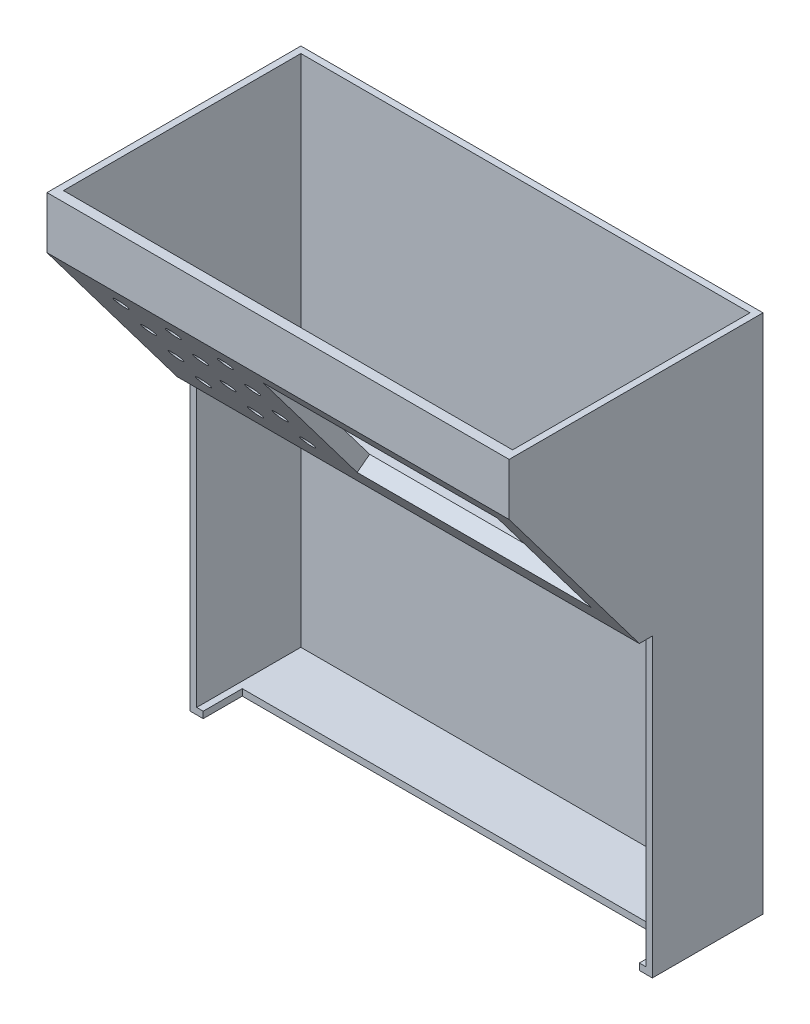
from build123d import *

# Parameters (mm, degrees)
SKETCH1_W                 = 200
SKETCH1_H                 = 177.5
BOSS_EXTRUDE1_DEPTH       = 2.5
BOSS_EXTRUDE2_DEPTH       = 40
SKETCH5_W                 = 86.25
SKETCH5_H                 = 95
BOSS_EXTRUDE3_DEPTH       = 2.5
CUT_EXTRUDE1_DEPTH        = 285.62694883
CUT_EXTRUDE1_DEPTH_BACK   = 285.62694883
BOSS_EXTRUDE4_START       = -177.5
BOSS_EXTRUDE4_DEPTH       = 177.5
SKETCH9_W                 = 167.5
SKETCH9_H                 = 15
CUT_EXTRUDE2_DEPTH        = 285.62694883
SKETCH15_R                = 2.65
CUT_EXTRUDE5_DEPTH        = 10
LPATTERN1_COUNT           = 4
LPATTERN1_PITCH           = 17.5
LPATTERN2_COUNT           = 3
LPATTERN2_PITCH           = 20
LPATTERN2_COPY_1_SKETCH_R = 2.65
LPATTERN2_COPY_1_DEPTH    = 10
LPATTERN2_COPY_2_SKETCH_R = 2.65
LPATTERN2_COPY_2_DEPTH    = 10
LPATTERN2_COPY_3_SKETCH_R = 2.65
LPATTERN2_COPY_3_DEPTH    = 10
LPATTERN2_COPY_4_SKETCH_R = 2.65
LPATTERN2_COPY_4_DEPTH    = 10
LPATTERN2_COPY_5_SKETCH_R = 2.65
LPATTERN2_COPY_5_DEPTH    = 10
LPATTERN2_COPY_6_SKETCH_R = 2.65
LPATTERN2_COPY_6_DEPTH    = 10
SKETCH16_W                = 90
SKETCH16_H                = 60
CUT_EXTRUDE6_DEPTH        = 10


# Read off the part's stored shape, not the designer's step: Boss-Extrude2
with BuildPart() as part:
    # Sketch1 → Boss-Extrude1 (new body)
    with BuildSketch(Plane(origin=(0, 0, 0), x_dir=(0, 1, 0), z_dir=(0, 0, 1))):
        with Locations((100, 88.75)):
            Rectangle(SKETCH1_W, SKETCH1_H)
    extrude(amount=BOSS_EXTRUDE1_DEPTH)

    # Boss-Extrude2 outline → Boss-Extrude2 (add)
    with BuildSketch(Plane.XY.offset(2.5)):
        Polygon((-177.5, 143.75), (-177.5, 0), (0, 0), (0, 143.75), (-2.5, 143.75), (-2.5, 2.5), (-175, 2.5), (-175, 143.75), align=None)
    extrude(amount=BOSS_EXTRUDE2_DEPTH)

    # Sketch5 → Boss-Extrude3 (add)
    with BuildSketch(Plane.YZ):
        with Locations((156.875, 50)):
            Rectangle(SKETCH5_W, SKETCH5_H)
    boss_extrude3 = extrude(amount=-BOSS_EXTRUDE3_DEPTH)

    # Mirror2: Boss-Extrude3 across plane
    add(boss_extrude3.mirror(Plane(origin=(-88.75, 0, 0), x_dir=(0, 0, 1), z_dir=(1, 0, 0))))

    # Sketch6 → Cut-Extrude1 (cut, two sides: drawn at the far end of the back side and taken through both)
    with BuildSketch(Plane.YZ.offset(-CUT_EXTRUDE1_DEPTH_BACK)):
        Polygon((113.75, 97.5), (113.75, 42.5), (180, 97.5), align=None)
    extrude(amount=CUT_EXTRUDE1_DEPTH + CUT_EXTRUDE1_DEPTH_BACK, mode=Mode.SUBTRACT)

    # Sketch7 → Boss-Extrude4 (add)
    with BuildSketch(Plane.YZ.offset(BOSS_EXTRUDE4_START)):
        Polygon((113.75, 47.5), (113.75, 42.5), (123.75, 42.5), (123.75, 47.5), (184.943404756, 93.683701702), (200, 93.683701702), (200, 97.5), (180, 97.5), align=None)
    extrude(amount=BOSS_EXTRUDE4_DEPTH)

    # Sketch9 → Cut-Extrude2 (cut, through all)
    with BuildSketch(Plane.XZ):
        with Locations((-88.75, 35)):
            Rectangle(SKETCH9_W, SKETCH9_H)
    extrude(amount=-CUT_EXTRUDE2_DEPTH, mode=Mode.SUBTRACT)

    # Sketch15 → Cut-Extrude5 (cut)
    with BuildSketch(Plane(origin=(0, 18.439555455, -24.432410978), x_dir=(1, 0, 0), z_dir=(0, -0.6024069059118725, 0.7981891503332306))):
        with Locations(Location((-157.5, 188.315762576, 0), (0, 0, 270))):
            Circle(SKETCH15_R)
    cut_extrude5 = extrude(amount=-CUT_EXTRUDE5_DEPTH, mode=Mode.SUBTRACT)

    # LPattern1: Cut-Extrude5 ×4
    with Locations(*[Vector(0, -0.7981891503332306, -0.6024069059118724) * (i * LPATTERN1_PITCH) for i in range(1, LPATTERN1_COUNT)]):
        add(cut_extrude5, mode=Mode.SUBTRACT)

    # LPattern2: Cut-Extrude5 ×3
    with Locations(*[(i * LPATTERN2_PITCH, 0, 0) for i in range(1, LPATTERN2_COUNT)]):
        add(cut_extrude5, mode=Mode.SUBTRACT)

    # LPattern2 copy 1 sketch → LPattern2 copy 1 (cut)
    with BuildSketch(Plane(origin=(20, 4.471245324, -34.974531831), x_dir=(1, 0, 0), z_dir=(0, -0.6024069059118725, 0.7981891503332306))):
        with Locations(Location((-157.5, 188.315762576, 0), (0, 0, 270))):
            Circle(LPATTERN2_COPY_1_SKETCH_R)
    extrude(amount=-LPATTERN2_COPY_1_DEPTH, mode=Mode.SUBTRACT)

    # LPattern2 copy 2 sketch → LPattern2 copy 2 (cut)
    with BuildSketch(Plane(origin=(40, 4.471245324, -34.974531831), x_dir=(1, 0, 0), z_dir=(0, -0.6024069059118725, 0.7981891503332306))):
        with Locations(Location((-157.5, 188.315762576, 0), (0, 0, 270))):
            Circle(LPATTERN2_COPY_2_SKETCH_R)
    extrude(amount=-LPATTERN2_COPY_2_DEPTH, mode=Mode.SUBTRACT)

    # LPattern2 copy 3 sketch → LPattern2 copy 3 (cut)
    with BuildSketch(Plane(origin=(20, -9.497064807, -45.516652684), x_dir=(1, 0, 0), z_dir=(0, -0.6024069059118725, 0.7981891503332306))):
        with Locations(Location((-157.5, 188.315762576, 0), (0, 0, 270))):
            Circle(LPATTERN2_COPY_3_SKETCH_R)
    extrude(amount=-LPATTERN2_COPY_3_DEPTH, mode=Mode.SUBTRACT)

    # LPattern2 copy 4 sketch → LPattern2 copy 4 (cut)
    with BuildSketch(Plane(origin=(40, -9.497064807, -45.516652684), x_dir=(1, 0, 0), z_dir=(0, -0.6024069059118725, 0.7981891503332306))):
        with Locations(Location((-157.5, 188.315762576, 0), (0, 0, 270))):
            Circle(LPATTERN2_COPY_4_SKETCH_R)
    extrude(amount=-LPATTERN2_COPY_4_DEPTH, mode=Mode.SUBTRACT)

    # LPattern2 copy 5 sketch → LPattern2 copy 5 (cut)
    with BuildSketch(Plane(origin=(20, -23.465374938, -56.058773538), x_dir=(1, 0, 0), z_dir=(0, -0.6024069059118725, 0.7981891503332306))):
        with Locations(Location((-157.5, 188.315762576, 0), (0, 0, 270))):
            Circle(LPATTERN2_COPY_5_SKETCH_R)
    extrude(amount=-LPATTERN2_COPY_5_DEPTH, mode=Mode.SUBTRACT)

    # LPattern2 copy 6 sketch → LPattern2 copy 6 (cut)
    with BuildSketch(Plane(origin=(40, -23.465374938, -56.058773538), x_dir=(1, 0, 0), z_dir=(0, -0.6024069059118725, 0.7981891503332306))):
        with Locations(Location((-157.5, 188.315762576, 0), (0, 0, 270))):
            Circle(LPATTERN2_COPY_6_SKETCH_R)
    extrude(amount=-LPATTERN2_COPY_6_DEPTH, mode=Mode.SUBTRACT)

    # Sketch16 → Cut-Extrude6 (cut)
    with BuildSketch(Plane(origin=(0, 18.439555455, -24.432410978), x_dir=(1, 0, 0), z_dir=(0, -0.6024069059118724, 0.7981891503332307))):
        with Locations((-55, 163.315762576)):
            Rectangle(SKETCH16_W, SKETCH16_H)
    extrude(amount=-CUT_EXTRUDE6_DEPTH, mode=Mode.SUBTRACT)


solid = part.part
